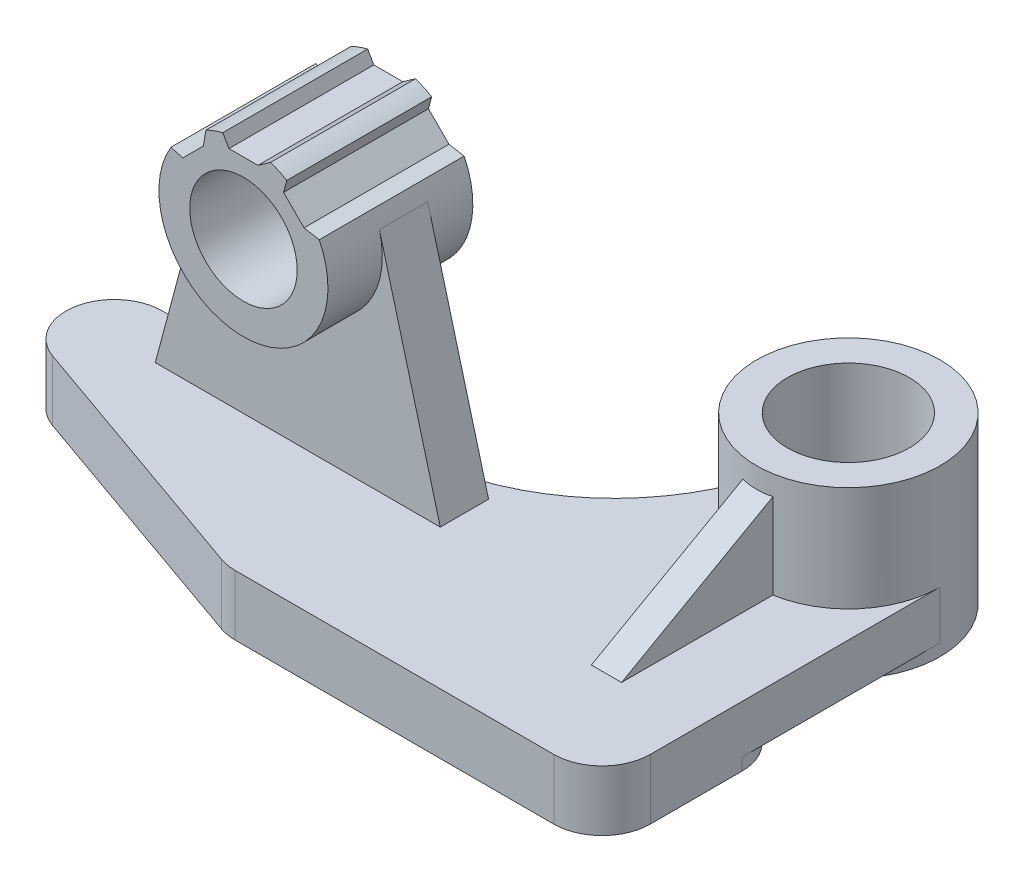
from build123d import *
from build123d.topology import SkipClean

# Parameters (mm, degrees)
BOSS_EXTRUDE1_DEPTH             = 20
BOSS_EXTRUDE3_START             = 5
BOSS_EXTRUDE3_DEPTH             = 5
SKETCH3_R                       = 38
BOSS_EXTRUDE4_DEPTH             = 68.5
SKETCH4_R                       = 25.25
CUT_EXTRUDE1_DEPTH              = 288.847616
BOSS_EXTRUDE5_START             = 62
BOSS_EXTRUDE5_DEPTH             = 20
BOSS_EXTRUDE6_START             = 44.5
SKETCH6_R                       = 35
BOSS_EXTRUDE6_DEPTH             = 60
CUT_EXTRUDE2_REACH              = 315.8
SKETCH7_R                       = 22.25
CUT_EXTRUDE3_REACH              = 315.8
CIRPATTERN1_COUNT               = 2
CIRPATTERN1_ANGLE               = 45
CIRPATTERN1_THE_OTHER_WAY_COUNT = 2
CIRPATTERN1_THE_OTHER_WAY_ANGLE = 45
RIB1_REACH                      = 314.198
SKETCH9_WALL_W                  = 697.750692
SKETCH9_WALL_H                  = 12.5


with BuildPart() as part:
    # Sketch1 → Boss-Extrude1 (new body)
    with BuildSketch(Plane(origin=(0, 0, 0), x_dir=(1, 0, 0), z_dir=(0, 1, 0))):
        with BuildLine():
            Line((38, 0), (38, -120))
            ThreePointArc((38, -120), (32.142136, -134.142136), (18, -140))
            Line((18, -140), (-114, -140))
            ThreePointArc((-114, -140), (-117.367124, -139.714525), (-120.638124, -138.866248))
            Line((-120.638124, -138.866248), (-228.638124, -100.866248))
            ThreePointArc((-228.638124, -100.866248), (-241.714525, -78.632876), (-222, -62))
            Line((-222, -62), (-124.89996, -62))
            ThreePointArc((-124.89996, -62), (-68.64996, -42.256227), (-37.079676, 8.3125))
            ThreePointArc((-37.079676, 8.3125), (4.181646, 37.769218), (38, 0))
        make_face()
    extrude(amount=BOSS_EXTRUDE1_DEPTH)

    # Sketch2 → Boss-Extrude3 (add)
    with BuildSketch(Plane.XZ.offset(BOSS_EXTRUDE3_START)):
        with BuildLine():
            Line((38, 82), (38, 120))
            ThreePointArc((38, 120), (32.142136, 134.142136), (18, 140))
            Line((18, 140), (-114, 140))
            ThreePointArc((-114, 140), (-117.367124, 139.714525), (-120.638124, 138.866248))
            Line((-120.638124, 138.866248), (-228.638124, 100.866248))
            ThreePointArc((-228.638124, 100.866248), (-241.714525, 78.632876), (-222, 62))
            Line((-222, 62), (18, 62))
            ThreePointArc((18, 62), (32.142136, 67.857864), (38, 82))
        make_face()
    extrude(amount=-BOSS_EXTRUDE3_DEPTH)

    # Sketch3 → Boss-Extrude4 (add)
    with BuildSketch(Plane.XZ.offset(5)):
        with Locations(Location((0, 0, 0), (0, 0, 270))):
            Circle(SKETCH3_R)
    extrude(amount=-BOSS_EXTRUDE4_DEPTH)

    # Sketch4 → Cut-Extrude1 (cut, through all)
    with BuildSketch(Plane(origin=(0, 63.5, 0), x_dir=(1, 0, 0), z_dir=(0, 1, 0))):
        with Locations(Location((0, 0, 0), (0, 0, 270))):
            Circle(SKETCH4_R)
    extrude(amount=-CUT_EXTRUDE1_DEPTH, mode=Mode.SUBTRACT)

    # Sketch5 → Boss-Extrude5 (add)
    with BuildSketch(Plane.XY.offset(BOSS_EXTRUDE5_START)):
        with BuildLine():
            Line((-205.010348, 20), (-179.807404, 114.058667))
            ThreePointArc((-179.807404, 114.058667), (-146, 140), (-112.192596, 114.058667))
            Line((-112.192596, 114.058667), (-86.989652, 20))
            Line((-86.989652, 20), (-205.010348, 20))
        make_face()
    extrude(amount=BOSS_EXTRUDE5_DEPTH)

    # Sketch6 → Boss-Extrude6 (add)
    with SkipClean():  # the faces are left unmerged after this step: merging them gives an invalid solid
        with BuildSketch(Plane.XY.offset(BOSS_EXTRUDE6_START)):
            with Locations((-146, 105)):
                Circle(SKETCH6_R)
        extrude(amount=BOSS_EXTRUDE6_DEPTH)

    # Sketch7 → Cut-Extrude2 (cut, up to next)
    with BuildSketch(Plane.XY.offset(104.5), mode=Mode.PRIVATE) as cut_extrude2_sk1:
        with Locations((-146, 105)):
            Circle(SKETCH7_R)
    cut_extrude2_tool1 = extrude(cut_extrude2_sk1.sketch, amount=-CUT_EXTRUDE2_REACH, mode=Mode.PRIVATE) & part.part
    cut_extrude2 = cut_extrude2_tool1.solids().sort_by_distance((-146, 105, 104.5))[0]
    add(cut_extrude2, mode=Mode.SUBTRACT)

    # Sketch8 → Cut-Extrude3 (cut, up to next)
    with BuildSketch(Plane.XY.offset(104.5), mode=Mode.PRIVATE) as cut_extrude3_sk1:
        with BuildLine():
            Line((-134.769081, 138.149155), (-140, 134.5))
            Line((-140, 134.5), (-152, 134.5))
            Line((-152, 134.5), (-154.561534, 138.936708))
            ThreePointArc((-154.561534, 138.936708), (-144.608431, 139.972325), (-134.769081, 138.149155))
        make_face()
    cut_extrude3_tool1 = extrude(cut_extrude3_sk1.sketch, amount=-CUT_EXTRUDE3_REACH, mode=Mode.PRIVATE) & part.part
    cut_extrude3 = cut_extrude3_tool1.solids().sort_by_distance((-145.282593, 137.243619, 104.5))[0]
    add(cut_extrude3, mode=Mode.SUBTRACT)

    # CirPattern1: Cut-Extrude2, Cut-Extrude3 ×2 about axis
    with SkipClean():  # the faces are left unmerged after this step: merging them gives an invalid solid
        cirpattern1_axis = Axis((-146, 105, 0), (0, 0, 1))
        add([cut_extrude2.rotate(cirpattern1_axis, i * CIRPATTERN1_ANGLE / (CIRPATTERN1_COUNT - 1)) for i in range(1, CIRPATTERN1_COUNT)], mode=Mode.SUBTRACT)
        add([cut_extrude3.rotate(cirpattern1_axis, i * CIRPATTERN1_ANGLE / (CIRPATTERN1_COUNT - 1)) for i in range(1, CIRPATTERN1_COUNT)], mode=Mode.SUBTRACT)

    # CirPattern1 the other way: Cut-Extrude2, Cut-Extrude3 ×2 about axis
    with SkipClean():  # the faces are left unmerged after this step: merging them gives an invalid solid
        cirpattern1_the_other_way_axis = Axis((-146, 105, 0), (0, 0, -1))
        add([cut_extrude2.rotate(cirpattern1_the_other_way_axis, i * CIRPATTERN1_THE_OTHER_WAY_ANGLE / (CIRPATTERN1_THE_OTHER_WAY_COUNT - 1)) for i in range(1, CIRPATTERN1_THE_OTHER_WAY_COUNT)], mode=Mode.SUBTRACT)
        add([cut_extrude3.rotate(cirpattern1_the_other_way_axis, i * CIRPATTERN1_THE_OTHER_WAY_ANGLE / (CIRPATTERN1_THE_OTHER_WAY_COUNT - 1)) for i in range(1, CIRPATTERN1_THE_OTHER_WAY_COUNT)], mode=Mode.SUBTRACT)

    # Sketch9 wall → Rib1 (add, up to next)
    with BuildSketch(Plane(origin=(0, 37.5, 69.090897), x_dir=(0, -0.490503322765, 0.871439321099), z_dir=(0, -0.871439321099, -0.490503322765)), mode=Mode.PRIVATE) as rib1_sk1:
        Rectangle(SKETCH9_WALL_W, SKETCH9_WALL_H)
    rib1_tool1 = extrude(rib1_sk1.sketch, amount=RIB1_REACH, mode=Mode.PRIVATE) - part.part
    add(rib1_tool1.solids().sort_by_distance((0, 37.5, 69.090897))[0])


solid = part.part
